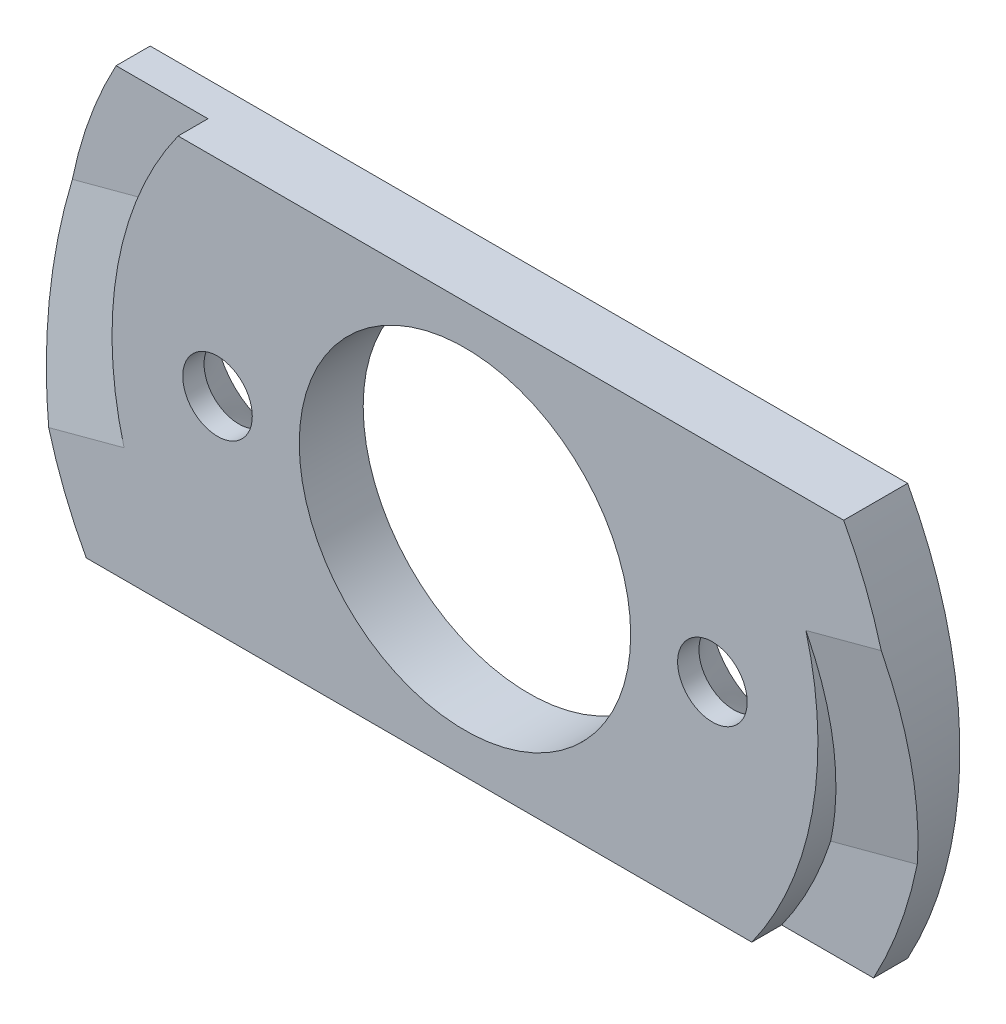
from build123d import *
from OCP.BRepFilletAPI import BRepFilletAPI_MakeChamfer

# Parameters (mm, degrees)
SKETCH1_R           = 7.774999999999999
SKETCH1_R_2         = 1.6319499986664014
BOSS_EXTRUDE1_DEPTH = 3
SKETCH1_3_R         = 1.6319499986664014
SKETCH1_3_R_2       = 7.774999999999999
BOSS_EXTRUDE2_DEPTH = 1.6
CHAMFER1_SIZE       = 2
CHAMFER1_SIZE2      = 1.5
CHAMFER2_SIZE2      = 1.4
CHAMFER2_SIZE       = 9
CHAMFER3_SIZE       = 1.4
CHAMFER3_SIZE_2     = 9


# Some blends are built 0.0001 mm under size
with BuildPart() as part:
    # Sketch1 → Boss-Extrude1 (new body)
    with BuildSketch(Plane.XY):
        with BuildLine():
            Line((-15.995731683346964, -4.286043386897756), (-19.531020207564957, -5.233321091972986))
            ThreePointArc((-19.53102020756496, -5.233321091972988), (-18.780139119855487, -7.49364895353884), (-17.76867749721403, -9.650000000000002))
            Line((-17.76867749721403, -9.65), (13.457752412643053, -9.650000000000004))
            ThreePointArc((13.457752412643053, -9.650000000000004), (16.29203049556925, -2.967042691206455), (15.995731683346978, 4.286043386897719))
            Line((15.995731683346953, 4.286043386897752), (19.531020207564957, 5.233321091972986))
            ThreePointArc((19.531020207564957, 5.233321091972985), (18.78013911985548, 7.493648953538841), (17.768677497214025, 9.650000000000002))
            Line((17.76867749721402, 9.650000000000002), (-13.457752412643053, 9.650000000000002))
            ThreePointArc((-13.457752412643051, 9.650000000000002), (-16.292030495569243, 2.967042691206453), (-15.995731683346973, -4.286043386897722))
        make_face()
        Circle(SKETCH1_R, mode=Mode.SUBTRACT)
        with Locations((11.610000000000001, 2.84e-15)):
            Circle(SKETCH1_R_2, mode=Mode.SUBTRACT)
        with Locations((-11.609999999999998, 0)):
            Circle(SKETCH1_R_2, mode=Mode.SUBTRACT)
    extrude(amount=BOSS_EXTRUDE1_DEPTH)

    # Sketch1<3> → Boss-Extrude2 (add)
    with BuildSketch(Plane.XY):
        with BuildLine():
            Line((-17.768677497214025, -9.649999999999999), (17.76867749721402, -9.650000000000002))
            ThreePointArc((17.76867749721402, -9.650000000000002), (20.22, 0), (17.76867749721402, 9.650000000000002))
            Line((17.76867749721402, 9.650000000000002), (-17.768677497214025, 9.649999999999999))
            ThreePointArc((-17.768677497214025, 9.649999999999999), (-20.220000000000002, 2.48e-15), (-17.768677497214025, -9.649999999999999))
        make_face()
        with Locations((-11.609999999999998, 0)):
            Circle(SKETCH1_3_R, mode=Mode.SUBTRACT)
        with Locations((11.610000000000001, 2.84e-15)):
            Circle(SKETCH1_3_R, mode=Mode.SUBTRACT)
        Circle(SKETCH1_3_R_2, mode=Mode.SUBTRACT)
    extrude(amount=BOSS_EXTRUDE2_DEPTH)

    # Chamfer1: one chamfer whose edges measure the first distance from different faces: ONE call of the kernel's chamfer builder (chamfer() names one face for all edges)
    chamfer1_edges_1 = [part.edges().sort_by_distance(p)[0] for p in [
        (-13.2419499986664, 2e-16, 0),
    ]]
    chamfer1_side_1 = [part.faces().sort_by_distance(p)[0] for p in [
        (-13.2419499986664, 2e-16, 1.5),
    ]]
    chamfer1_edges_2 = [part.edges().sort_by_distance(p)[0] for p in [
        (9.9780500013336, 3.04e-15, 0),
    ]]
    chamfer1_side_2 = [part.faces().sort_by_distance(p)[0] for p in [
        (9.9780500013336, 3.04e-15, 1.5),
    ]]
    chamfer1 = BRepFilletAPI_MakeChamfer(part.part.solid().wrapped)
    for e in chamfer1_edges_1:
        chamfer1.Add(CHAMFER1_SIZE, CHAMFER1_SIZE2, e.wrapped, chamfer1_side_1[0].wrapped)  # the first distance lies on this face
    for e in chamfer1_edges_2:
        chamfer1.Add(CHAMFER1_SIZE, CHAMFER1_SIZE2, e.wrapped, chamfer1_side_2[0].wrapped)  # the first distance lies on this face
    add(Compound.cast(chamfer1.Shape()), mode=Mode.REPLACE)

    # Chamfer2
    chamfer2_edges = [part.edges().sort_by_distance(p)[0] for p in [
        (-17.763375945455962, -4.759682239435371, 1.6),
    ]]
    chamfer2_side = [part.faces().sort_by_distance(p)[0] for p in [
        (-17.770622878718832, -4.732636316299277, 1.6),
    ]]
    chamfer(chamfer2_edges, length=CHAMFER2_SIZE - 0.0001, length2=CHAMFER2_SIZE2 - 0.0001, reference=chamfer2_side[0])  # a hair under: the kernel refuses the full size

    # Chamfer3
    # the kernel refuses this chamfer: 9, 1.4 mm, written as the material it adds along each edge
    with BuildSketch(Plane(origin=(-6.596997055985572, -1.7676600336218398, 1.6), x_dir=(-0.06145306059893889, 0.22934594443584813, 0.9714030878651004), z_dir=(0.9659258262890681, 0.2588190451025218, 0))) as chamfer3_piece_1_section:
        Polygon((CHAMFER3_SIZE * 0.971403087865, CHAMFER3_SIZE * 0.237436393348), (-CHAMFER3_SIZE_2 * 0.237436393348, CHAMFER3_SIZE_2 * 0.971403087865), (0, 0), align=None)
    chamfer3_piece_1 = extrude(amount=50.43942782859462, mode=Mode.PRIVATE)
    chamfer3_piece_1 = split(chamfer3_piece_1, bisect_by=Plane(origin=(18.152512128886663, 1.3968714371036275, 3), z_dir=(0, 0, -1)), keep=Keep.TOP, mode=Mode.PRIVATE)
    chamfer3_piece_1 = chamfer3_piece_1 & Plane(origin=(-9.0949e-13, -3.5172e-13, 1.9557710563894077), x_dir=(0.9659258262890668, 0.2588190451025265, 0), z_dir=(0, 0, -1)) * Cylinder(20.22000000000097, 136, mode=Mode.PRIVATE)
    chamfer3_piece_1 = chamfer3_piece_1 - Plane(origin=(2.665e-14, -4.11e-15, 1.9557710563894077), x_dir=(0.8126662084929376, -0.5827294685990347, 0), z_dir=(0, 0, -1)) * Cylinder(16.559999999999974, 136, mode=Mode.PRIVATE)
    add(chamfer3_piece_1)


solid = part.part
